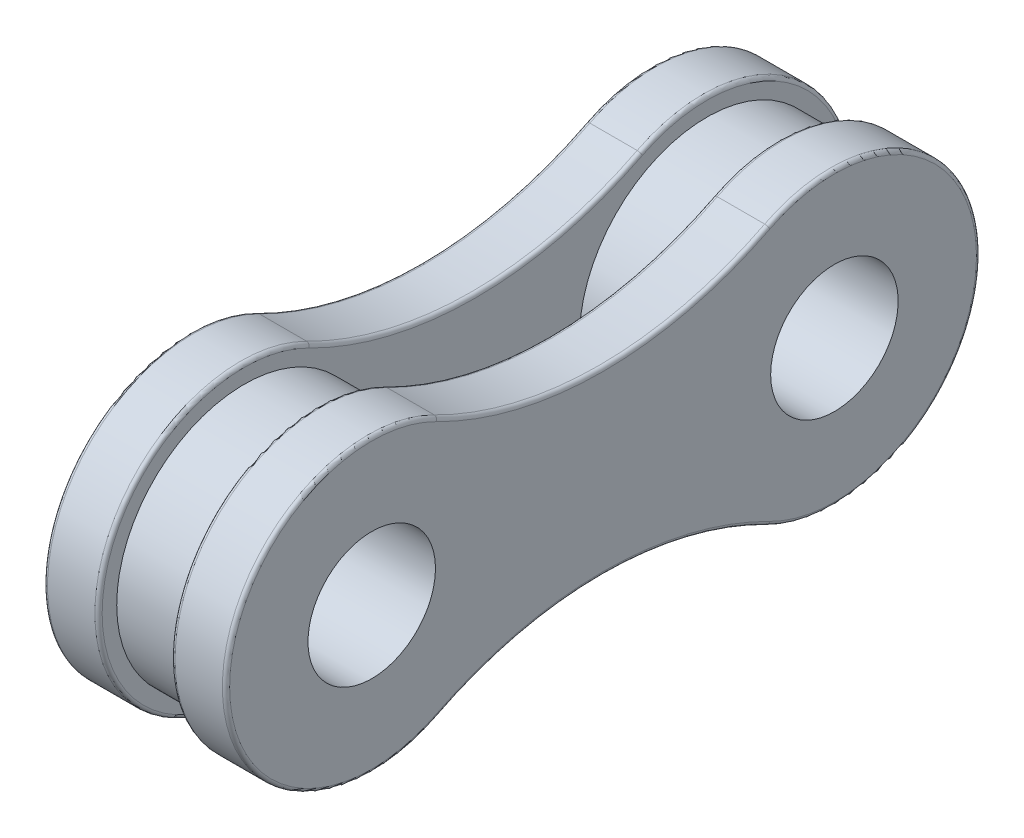
from build123d import *

# Parameters (mm, degrees)
BOSS_EXTRUDE1_START = 1
SKETCH1_R           = 1.75
BOSS_EXTRUDE1_DEPTH = 1.5
BOSS_EXTRUDE2_START = -1
SKETCH2_R           = 1.75
BOSS_EXTRUDE2_DEPTH = 1.5
SKETCH3_R           = 3.5
SKETCH3_R_2         = 1.75
BOSS_EXTRUDE3_DEPTH = 1
FILLET1_R           = 0.1


with BuildPart() as part:
    # Sketch1 → Boss-Extrude1 (new body)
    with BuildSketch(Plane(origin=(0, 0, 0), x_dir=(0, 0, -1), z_dir=(1, 0, 0)).offset(BOSS_EXTRUDE1_START)):
        with BuildLine():
            ThreePointArc((-4.535714286, 3.56487971), (-10.35, 0), (-4.535714286, -3.56487971))
            ThreePointArc((-4.535714286, -3.56487971), (0, -2.477078985), (4.535714286, -3.56487971))
            ThreePointArc((4.535714286, -3.56487971), (10.35, 0), (4.535714286, 3.56487971))
            ThreePointArc((4.535714286, 3.56487971), (0, 2.477078985), (-4.535714286, 3.56487971))
        make_face()
        with Locations((-6.35, 0)):
            Circle(SKETCH1_R, mode=Mode.SUBTRACT)
        with Locations((6.35, 0)):
            Circle(SKETCH1_R, mode=Mode.SUBTRACT)
    extrude(amount=BOSS_EXTRUDE1_DEPTH)



with BuildPart() as body_2:
    # Sketch2 → Boss-Extrude2 (new body)
    with BuildSketch(Plane(origin=(0, 0, 0), x_dir=(0, 0, -1), z_dir=(1, 0, 0)).offset(BOSS_EXTRUDE2_START)):
        with BuildLine():
            ThreePointArc((4.535714286, -3.56487971), (0, -2.477078985), (-4.535714286, -3.56487971))
            ThreePointArc((-4.535714286, -3.56487971), (-10.35, 0), (-4.535714286, 3.56487971))
            ThreePointArc((-4.535714286, 3.56487971), (0, 2.477078985), (4.535714286, 3.56487971))
            ThreePointArc((4.535714286, 3.56487971), (10.35, 0), (4.535714286, -3.56487971))
        make_face()
        with Locations((-6.35, 0)):
            Circle(SKETCH2_R, mode=Mode.SUBTRACT)
        with Locations((6.35, 0)):
            Circle(SKETCH2_R, mode=Mode.SUBTRACT)
    extrude(amount=-BOSS_EXTRUDE2_DEPTH)


with BuildPart() as part_1:
    add(part.part)

    add(body_2.part)  # Boss-Extrude3 merges body 2
    # Sketch3 → Boss-Extrude3 (add, symmetric)
    # profile 1 of 2: a face of its own
    with BuildSketch(Plane(origin=(0, 0, 0), x_dir=(0, 0, -1), z_dir=(1, 0, 0))):
        with Locations((6.35, 0)):
            Circle(SKETCH3_R)
        with Locations((6.35, 0)):
            Circle(SKETCH3_R_2, mode=Mode.SUBTRACT)
    # profile 2 of 2: a face of its own
    with BuildSketch(Plane(origin=(0, 0, 0), x_dir=(0, 0, -1), z_dir=(1, 0, 0))):
        with Locations((-6.35, 0)):
            Circle(SKETCH3_R)
        with Locations((-6.35, 0)):
            Circle(SKETCH3_R_2, mode=Mode.SUBTRACT)
    extrude(amount=BOSS_EXTRUDE3_DEPTH, both=True)

    # Fillet1
    fillet1_edges = [part_1.edges().sort_by_distance(p)[0] for p in [
        (2.5, 0, 10.35),
        (2.5, 2.477078985, 0),
        (2.5, 0, -10.35),
        (1, 0, 10.35),
        (1, 2.477078985, 0),
        (1, 0, -10.35),
        (-1, 0, 10.35),
        (-1, 2.477078985, 0),
        (-1, 0, -10.35),
        (-2.5, 0, 10.35),
        (-2.5, 2.477078985, 0),
        (-2.5, 0, -10.35),
        (2.5, -2.477078985, 0),
        (1, -2.477078985, 0),
        (-1, -2.477078985, 0),
        (-2.5, -2.477078985, 0),
    ]]
    fillet(fillet1_edges, radius=FILLET1_R)


solid = part_1.part
